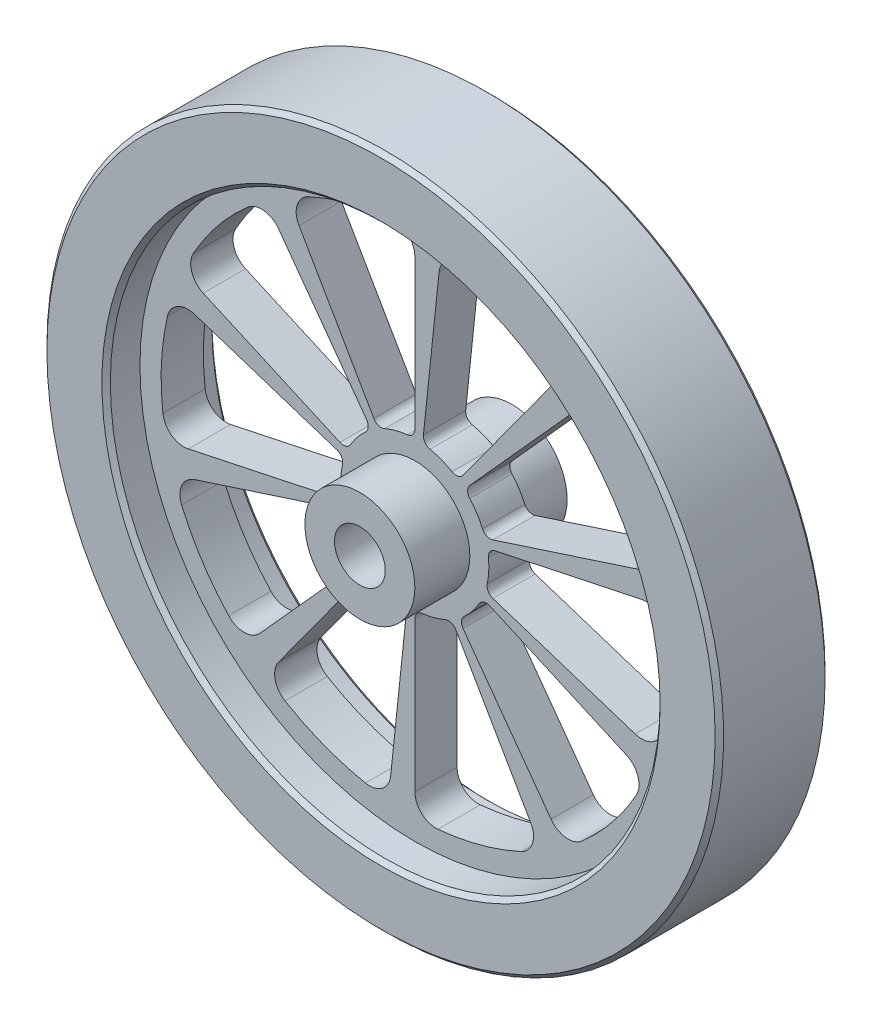
from build123d import *

# Parameters (mm, degrees)
SKETCH3_R           = 80
SKETCH3_R_2         = 6
BOSS_EXTRUDE2_DEPTH = 13
SKETCH4_R           = 65
CUT_EXTRUDE3_DEPTH  = 8
SKETCH5_R           = 13
SKETCH5_R_2         = 6
BOSS_EXTRUDE3_DEPTH = 18
CHAMFER1_SIZE       = 1
CUT_EXTRUDE4_DEPTH  = 116.451288429
CIRPATTERN1_COUNT   = 10


with BuildPart() as part:
    # Sketch3 → Boss-Extrude2 (new, symmetric)
    with BuildSketch(Plane.XY):
        Circle(SKETCH3_R)
        Circle(SKETCH3_R_2, mode=Mode.SUBTRACT)
    extrude(amount=BOSS_EXTRUDE2_DEPTH, both=True)

    # Sketch4 → Cut-Extrude3 (cut)
    with BuildSketch(Plane.XY.offset(13)):
        Circle(SKETCH4_R)
    cut_extrude3 = extrude(amount=-CUT_EXTRUDE3_DEPTH, mode=Mode.SUBTRACT)

    # Mirror2: Cut-Extrude3 across plane
    add(cut_extrude3.mirror(Plane.XY), mode=Mode.SUBTRACT)

    # Sketch5 → Boss-Extrude3 (add, symmetric)
    with BuildSketch(Plane.XY):
        Circle(SKETCH5_R)
        Circle(SKETCH5_R_2, mode=Mode.SUBTRACT)
    extrude(amount=BOSS_EXTRUDE3_DEPTH, both=True)

    # Chamfer1
    chamfer1_edges = [part.edges().sort_by_distance(p)[0] for p in [
        (-80, 0, -13),
        (-65, 0, -13),
        (-80, 0, 13),
        (-65, 0, 13),
    ]]
    chamfer(chamfer1_edges, length=CHAMFER1_SIZE)

    # Sketch6 → Cut-Extrude4 (cut, through all)
    with BuildSketch(Plane.XY.offset(5)):
        with BuildLine():
            Line((-27.386127875, 47.434164903), (-9.698582371, 16.798437427))
            ThreePointArc((-9.698582371, 16.798437427), (-8.582686936, 15.895715021), (-7.149451403, 15.972956666))
            ThreePointArc((-7.149451403, 15.972956666), (-4.529333289, 16.90370196), (-1.794871795, 17.407711947))
            ThreePointArc((-1.794871795, 17.407711947), (-0.515032591, 18.057436487), (0, 19.397164741))
            Line((0, 19.397164741), (0, 54.772255751))
            ThreePointArc((0, 54.772255751), (-1.629000688, 58.46500048), (-5.454545455, 59.751551728))
            ThreePointArc((-5.454545455, 59.751551728), (-15.529142706, 57.955549577), (-25.152000934, 54.473634439))
            ThreePointArc((-25.152000934, 54.473634439), (-27.821744262, 51.446675992), (-27.386127875, 47.434164903))
        make_face()
    cut_extrude4 = extrude(amount=-CUT_EXTRUDE4_DEPTH, mode=Mode.SUBTRACT)

    # CirPattern1: Cut-Extrude4 ×10 about axis
    cirpattern1_axis = Axis((0, 0, 5), (0, 0, 1))
    for i in range(1, CIRPATTERN1_COUNT):
        add(cut_extrude4.rotate(cirpattern1_axis, i * 360 / CIRPATTERN1_COUNT), mode=Mode.SUBTRACT)


solid = part.part
